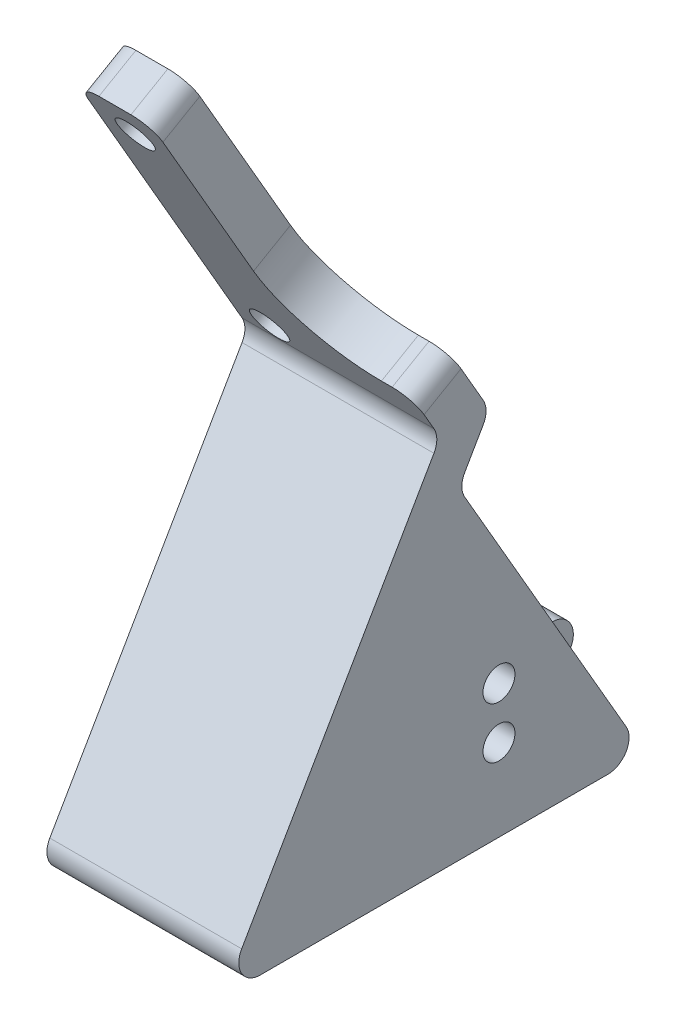
from build123d import *

# Parameters (mm, degrees)
BOSS_EXTRU_1_DEPTH      = 18
ENL_V_MAT_EXTRU_1_REACH = 82.979
ESQUISSE4_W             = 11
ESQUISSE4_H             = 27
ENL_V_MAT_EXTRU_2_DEPTH = 11
D_GAGEMENT_M31_D        = 3.4
ENL_V_MAT_EXTRU_3_DEPTH = 8.4
ESQUISSE10_R            = 0.9
ENL_V_MAT_EXTRU_4_DEPTH = 4
ENL_V_MAT_EXTRU_5_DEPTH = 5
CONG_1_R                = 2
CONG_2_R                = 8
ENL_V_START             = -1.6
ESQUISSE13_R            = 1.5
ENL_V_MAT_EXTRU_6_DEPTH = 78.3514199


with BuildPart() as part:
    # Esquisse1 → Boss.-Extru.1 (new body)
    with BuildSketch(Plane(origin=(0, 0, 0), x_dir=(0, 0, -1), z_dir=(1, 0, 0))):
        Polygon((-37.5, 64.951905284), (-40.964101615, 62.951905284), (-24.964101615, 35.239092363), (-45.309401077, 0), (0, 0), (-2.309401077, 4), (-8.082903769, 4), (-23.232050808, 30.239092363), (-20.345299462, 35.239092363), align=None)
    extrude(amount=BOSS_EXTRU_1_DEPTH)

    # Esquisse4 → Enlèv. mat.-Extru.1 (cut, up to next)
    with BuildSketch(Plane(origin=(0, -2, 3.464101615), x_dir=(1, 0, 0), z_dir=(0, -0.5000000000000047, 0.8660254037844359)), mode=Mode.PRIVATE) as enl_v_mat_extru_1_sk1:
        with Locations((12.5, 61.5)):
            Rectangle(ESQUISSE4_W, ESQUISSE4_H)
    enl_v_mat_extru_1_tool1 = extrude(enl_v_mat_extru_1_sk1.sketch, amount=-ENL_V_MAT_EXTRU_1_REACH, mode=Mode.PRIVATE) & part.part
    add(enl_v_mat_extru_1_tool1.solids().sort_by_distance((12.5, 51.260562, 34.214102))[0], mode=Mode.SUBTRACT)

    # Esquisse6 → Enlèv. mat.-Extru.2 (cut)
    with BuildSketch(Plane(origin=(18, 0, 0), x_dir=(0, 0, -1), z_dir=(1, 0, 0))):
        Polygon((0, 0), (-2.309401077, 4), (-8.082903769, 4), (-5.773502692, 0), align=None)
    extrude(amount=-ENL_V_MAT_EXTRU_2_DEPTH, mode=Mode.SUBTRACT)

    # Dégagement M31 (through all)
    with Locations(Plane(origin=(0, 0, 0), x_dir=(-1, 0, 0), z_dir=(0, 0.5000000000000047, -0.866025403784436))):
        with Locations((-3.5, 71.2), (-3.5, 46)):
            Hole(D_GAGEMENT_M31_D / 2)

    # Esquisse9 → Enlèv. mat.-Extru.3 (cut)
    with BuildSketch(Plane.ZY):
        with BuildLine():
            Line((19.441451884, 15.2), (20.441451884, 16.2))
            Line((20.441451884, 16.2), (30.641451884, 16.2))
            Line((30.641451884, 16.2), (31.641451884, 15.2))
            Line((31.641451884, 15.2), (31.641451884, 13.4))
            ThreePointArc((31.641451884, 13.4), (32.541451884, 12.5), (31.641451884, 11.6))
            Line((31.641451884, 11.6), (31.641451884, 8.6))
            ThreePointArc((31.641451884, 8.6), (32.541451884, 7.7), (31.641451884, 6.8))
            Line((31.641451884, 6.8), (31.641451884, 5))
            Line((31.641451884, 5), (30.641451884, 4))
            Line((30.641451884, 4), (20.441451884, 4))
            Line((20.441451884, 4), (19.441451884, 5))
            Line((19.441451884, 5), (19.441451884, 6.8))
            ThreePointArc((19.441451884, 6.8), (18.541451884, 7.7), (19.441451884, 8.6))
            Line((19.441451884, 8.6), (19.441451884, 11.6))
            ThreePointArc((19.441451884, 11.6), (18.541451884, 12.5), (19.441451884, 13.4))
            Line((19.441451884, 13.4), (19.441451884, 15.2))
        make_face()
    extrude(amount=-ENL_V_MAT_EXTRU_3_DEPTH, mode=Mode.SUBTRACT)

    # Esquisse10 → Enlèv. mat.-Extru.4 (cut)
    with BuildSketch(Plane.ZY.offset(-8.4)):
        with Locations((19.441451884, 12.5)):
            Circle(ESQUISSE10_R)
        with Locations((19.441451884, 7.7)):
            Circle(ESQUISSE10_R)
        with Locations((31.641451884, 12.5)):
            Circle(ESQUISSE10_R)
        with Locations((31.641451884, 7.7)):
            Circle(ESQUISSE10_R)
    extrude(amount=-ENL_V_MAT_EXTRU_4_DEPTH, mode=Mode.SUBTRACT)

    # Esquisse11 → Enlèv. mat.-Extru.5 (cut)
    with BuildSketch(Plane.ZY):
        Polygon((25.541451884, 26.239092363), (12.701705922, 4), (38.381197846, 4), align=None)
    extrude(amount=-ENL_V_MAT_EXTRU_5_DEPTH, mode=Mode.SUBTRACT)

    # Congé1
    cong_1_edges = [part.edges().sort_by_distance(p)[0] for p in [
        (0, 63.951905284, 39.232050808),
        (2.5, 4, 38.381197846),
        (2.5, 26.239092363, 25.541451884),
        (2.5, 4, 12.701705922),
        (9, 0, 45.309401077),
        (9, 35.239092363, 24.964101615),
        (9, 35.239092363, 20.345299462),
        (9, 30.239092363, 23.232050808),
        (18, 40.569219382, 25.732050808),
        (7, 63.951905284, 39.232050808),
        (3.5, 0, 0),
        (3.5, 4, 8.082903769),
        (3.5, 4, 2.309401077),
        (12.5, 0, 5.773502692),
    ]]
    fillet(cong_1_edges, radius=CONG_1_R - 0.0001)  # a hair under: the kernel refuses the full size

    # Congé2
    cong_2_edges = [part.edges().sort_by_distance(p)[0] for p in [
        (7, 40.569219382, 25.732050808),
    ]]
    fillet(cong_2_edges, radius=CONG_2_R)

    # Esquisse13 → Enlèv. mat.-Extru.6 (cut, through all)
    with BuildSketch(Plane.ZY.offset(-8.4).offset(ENL_V_START)):
        with Locations((19.441451884, 12.5)):
            Circle(ESQUISSE13_R)
        with Locations((19.441451884, 7.7)):
            Circle(ESQUISSE13_R)
    extrude(amount=-ENL_V_MAT_EXTRU_6_DEPTH, mode=Mode.SUBTRACT)


solid = part.part
